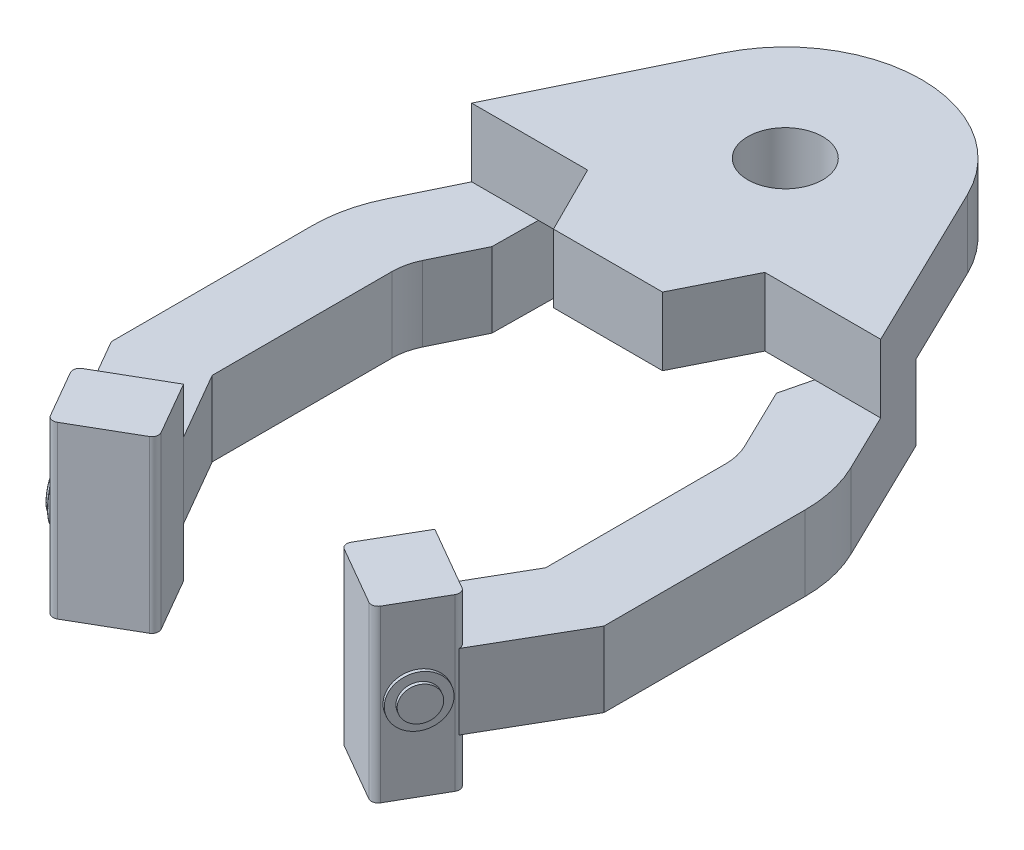
from build123d import *

# Parameters (mm, degrees)
SKETCH1_R           = 0.55
BOSS_EXTRUDE1_DEPTH = 1
BOSS_EXTRUDE3_DEPTH = 1.1
BOSS_EXTRUDE4_DEPTH = 1.25
SKETCH5_R           = 0.375
BOSS_EXTRUDE5_DEPTH = 0.05
SKETCH6_R           = 0.25
BOSS_EXTRUDE6_DEPTH = 0.05
CHAMFER1_SIZE       = 0.75
CHAMFER1_SIZE_2     = 0.5
MIRROR1_START       = -1.1
MIRROR1_DEPTH       = 1.1
MIRROR1_START_2     = -1.8
MIRROR1_2_DEPTH     = 2.5
MIRROR1_START_3     = 6.27611275
MIRROR1_3_OUTLINE_R = 0.375
MIRROR1_3_DEPTH     = 0.05
MIRROR1_START_4     = 6.32611275
MIRROR1_4_OUTLINE_R = 0.25
MIRROR1_4_DEPTH     = 0.05
FILLET2_R           = 0.05
BOSS_EXTRUDE7_DEPTH = 1
FILLET3_R           = 0.1


with BuildPart() as part:
    # Sketch1 → Boss-Extrude1 (new body)
    with BuildSketch(Plane(origin=(0, 0, 0), x_dir=(1, 0, 0), z_dir=(0, 1, 0))):
        with BuildLine():
            Line((-3, -1.6), (-1.799182122, 0.873466479))
            ThreePointArc((-1.799182122, 0.873466479), (0, 2), (1.799182122, 0.873466479))
            Line((1.799182122, 0.873466479), (3, -1.6))
            Line((3, -1.6), (-3, -1.6))
        make_face()
        with Locations(Location((0, 0, 0), (0, 0, 270))):
            Circle(SKETCH1_R, mode=Mode.SUBTRACT)
    extrude(amount=BOSS_EXTRUDE1_DEPTH)

    # Sketch3 → Boss-Extrude3 (add)
    with BuildSketch(Plane(origin=(0, 0, 0), x_dir=(-1, 0, 0), z_dir=(0, -1, 0))):
        with BuildLine():
            Line((2.514520254, -0.6), (3.412657784, -2.45))
            ThreePointArc((3.412657784, -2.45), (3.562510993, -2.875016795), (3.613323348, -3.322803983))
            Line((3.613323348, -3.322803983), (3.613323348, -6.273765877))
            Line((3.613323348, -6.273765877), (2.863323348, -7.572803983))
            Line((2.863323348, -7.572803983), (1.851870719, -6.988841535))
            Line((1.851870719, -6.988841535), (2.445398453, -5.960821345))
            Line((2.445398453, -5.960821345), (2.445398453, -3.322803983))
            ThreePointArc((2.445398453, -3.322803983), (2.424281128, -3.13670618), (2.362002989, -2.960071623))
            Line((2.362002989, -2.960071623), (1.701715763, -1.6))
            Line((1.701715763, -1.6), (2.514520254, -0.6))
        make_face()
    extrude(amount=BOSS_EXTRUDE3_DEPTH)

    # Sketch4 → Boss-Extrude4 (add, symmetric)
    with BuildSketch(Plane(origin=(2.003180044, -0.55, 0.513767997), x_dir=(1, 0, 0), z_dir=(0, 1, 0))):
        Polygon((-3.84639051, -6.470073538), (-4.875163646, -7.064035986), (-4.375163646, -7.930061389), (-3.34639051, -7.336098942), align=None)
    extrude(amount=BOSS_EXTRUDE4_DEPTH, both=True)

    # Sketch5 → Boss-Extrude5 (add)
    with BuildSketch(Plane(origin=(-5.435273078, 0, 3.138056375), x_dir=(0.5000000000000009, 0, 0.8660254037844383), z_dir=(-0.8660254037844382, 0, 0.5000000000000008))):
        with Locations((5.626578953, -0.55)):
            Circle(SKETCH5_R)
    extrude(amount=BOSS_EXTRUDE5_DEPTH)

    # Sketch6 → Boss-Extrude6 (add)
    with BuildSketch(Plane(origin=(-5.478574348, 0, 3.163056375), x_dir=(0.5000000000000008, 0, 0.8660254037844383), z_dir=(-0.8660254037844382, 0, 0.5000000000000007))):
        with Locations((5.626578953, -0.55)):
            Circle(SKETCH6_R)
    extrude(amount=BOSS_EXTRUDE6_DEPTH)

    # Chamfer1
    # the kernel refuses this chamfer: 0.75, 0.5 mm, written as the material it takes off along each edge
    with BuildSketch(Plane(origin=(-1.701715763, 0, 1.6), x_dir=(-0.43673323969900685, 0, 0.899591061172803), z_dir=(0, -1, 0))) as chamfer1_piece_1:
        Polygon((CHAMFER1_SIZE, 0), (-CHAMFER1_SIZE_2 * 0.422618261741, CHAMFER1_SIZE_2 * 0.906307787037), (0, 0), align=None)
    extrude(amount=3.043103543, mode=Mode.SUBTRACT)

    # Mirror1: read off the stored shape, not the designer's step
    # Mirror1 outline → Mirror1 (add)
    with BuildSketch(Plane(origin=(0, 0, 0), x_dir=(1, 0, 0), z_dir=(0, 1, 0)).offset(MIRROR1_START)):
        with BuildLine():
            Line((3.412657784, -2.45), (2.514520254, -0.6))
            Line((2.514520254, -0.6), (2.174766969, -1.01800124))
            Line((2.174766969, -1.01800124), (1.920082383, -2.049795531))
            Line((1.920082383, -2.049795531), (2.362002989, -2.960071623))
            ThreePointArc((2.362002989, -2.960071623), (2.424281128, -3.13670618), (2.445398453, -3.322803983))
            Line((2.445398453, -3.322803983), (2.445398453, -5.960821345))
            Line((2.445398453, -5.960821345), (1.851870719, -6.988841535))
            Line((1.851870719, -6.988841535), (1.843210465, -6.983841535))
            Line((1.843210465, -6.983841535), (1.343210465, -7.849866939))
            Line((1.343210465, -7.849866939), (2.371983602, -8.443829386))
            Line((2.371983602, -8.443829386), (2.871983602, -7.577803983))
            Line((2.871983602, -7.577803983), (2.863323348, -7.572803983))
            Line((2.863323348, -7.572803983), (3.613323348, -6.273765877))
            Line((3.613323348, -6.273765877), (3.613323348, -3.322803983))
            ThreePointArc((3.613323348, -3.322803983), (3.562510993, -2.875016795), (3.412657784, -2.45))
        make_face()
    extrude(amount=MIRROR1_DEPTH)

    # Mirror1 2 outline → Mirror1 2 (add)
    with BuildSketch(Plane(origin=(0, 0, 0), x_dir=(1, 0, 0), z_dir=(0, 1, 0)).offset(MIRROR1_START_2)):
        Polygon((2.871983602, -7.577803983), (1.843210465, -6.983841535), (1.343210465, -7.849866939), (2.371983602, -8.443829386), align=None)
    extrude(amount=MIRROR1_2_DEPTH)

    # Mirror1 3 outline → Mirror1 3 (add)
    with BuildSketch(Plane(origin=(0, 0, 0), x_dir=(0.500000000000001, 0, -0.866025403784438), z_dir=(0.866025403784438, 0, 0.500000000000001)).offset(MIRROR1_START_3)):
        with Locations((-5.626578953, -0.55)):
            Circle(MIRROR1_3_OUTLINE_R)
    extrude(amount=MIRROR1_3_DEPTH)

    # Mirror1 4 outline → Mirror1 4 (add)
    with BuildSketch(Plane(origin=(0, 0, 0), x_dir=(0.500000000000001, 0, -0.866025403784438), z_dir=(0.866025403784438, 0, 0.500000000000001)).offset(MIRROR1_START_4)):
        with Locations((-5.626578953, -0.55)):
            Circle(MIRROR1_4_OUTLINE_R)
    extrude(amount=MIRROR1_4_DEPTH)

    # Fillet2
    fillet2_edges = [part.edges().sort_by_distance(p)[0] for p in [
        (-2.852784872, -0.55, 7.711057158),
        (-2.833586142, -0.55, 7.844310334),
    ]]
    fillet(fillet2_edges, radius=FILLET2_R - 0.0001)  # a hair under: the kernel refuses the full size

    # Sketch7 → Boss-Extrude7 (add)
    with BuildSketch(Plane(origin=(0, 0, 0), x_dir=(1, 0, 0), z_dir=(0, 1, 0))):
        Polygon((-0.8, -2.6), (0.8, -2.6), (1.3, -1.6), (0, -0.8), (-1.3, -1.6), align=None)
    extrude(amount=BOSS_EXTRUDE7_DEPTH)

    # Fillet3
    # the kernel refuses this fillet: 0.1 mm, written as the material it takes off along each edge
    with BuildSketch(Plane(origin=(2.871983602, -1.1, 7.577803983), x_dir=(-0.8660254028383251, 0, -0.5000000016387168), z_dir=(0, 1, 0))) as fillet3_piece_1_section:
        with BuildLine():
            CenterArc((FILLET3_R * 0.9999999985, FILLET3_R), FILLET3_R, 180.000000086, 89.999999914)
            Line((-FILLET3_R * 1.50001067123e-09, FILLET3_R * 0.9999999985), (0, 0))
            Line((0, 0), (FILLET3_R * 0.9999999985, 0))
        make_face()
    fillet3_piece_1 = extrude(amount=1.1, mode=Mode.PRIVATE)
    fillet3_piece_1 = split(fillet3_piece_1, bisect_by=Plane(origin=(2.863323348, -1.1, 7.572803983), z_dir=(0.8660254038383292, 0, 0.49999999990665916)), keep=Keep.TOP, mode=Mode.PRIVATE)
    add(fillet3_piece_1, mode=Mode.SUBTRACT)
    with BuildSketch(Plane(origin=(2.371983602, 0.95, 8.443829386), x_dir=(0.5000000003396727, 0, -0.8660254035883286), z_dir=(0, -1, 0)), Plane(origin=(1.343210465, -2.05, 7.849866939), x_dir=(0.4999999999066601, 0, -0.8660254038383285), z_dir=(0, 1, 0)), Plane(origin=(-2.371983602, -2.05, 8.443829386), x_dir=(-0.5000000000000007, 0, -0.8660254037844383), z_dir=(0, 1, 0))) as fillet3_piece_2:
        with BuildLine():
            CenterArc((FILLET3_R, -FILLET3_R), FILLET3_R, 90, 89.999999953)
            Line((0, -FILLET3_R), (0, 0))
            Line((0, 0), (FILLET3_R, 0))
        make_face()
    extrude(amount=3, mode=Mode.SUBTRACT)
    with BuildSketch(Plane(origin=(-2.871983602, -2.05, 7.577803983), x_dir=(0.5000000000000002, 0, 0.8660254037844386), z_dir=(0, 1, 0))) as fillet3_piece_3_section:
        with BuildLine():
            CenterArc((FILLET3_R, FILLET3_R), FILLET3_R, 180, 90)
            Line((0, FILLET3_R), (0, 0))
            Line((0, 0), (FILLET3_R, 0))
        make_face()
    fillet3_piece_3 = extrude(amount=3, mode=Mode.PRIVATE)
    fillet3_piece_3 = split(fillet3_piece_3, bisect_by=Plane(origin=(-2.871983602, -1.1, 7.577803983), z_dir=(0, -1, 0)), keep=Keep.TOP, mode=Mode.PRIVATE)
    fillet3_piece_3 = split(fillet3_piece_3, bisect_by=Plane(origin=(-2.863323348, -2.05, 7.572803983), z_dir=(-0.8660254037844362, 0, 0.5000000000000044)), keep=Keep.TOP, mode=Mode.PRIVATE)
    add(fillet3_piece_3, mode=Mode.SUBTRACT)
    with BuildSketch(Plane(origin=(-2.871983602, -2.05, 7.577803983), x_dir=(0.5000000000000002, 0, 0.8660254037844386), z_dir=(0, 1, 0))) as fillet3_piece_4_section:
        with BuildLine():
            CenterArc((FILLET3_R, FILLET3_R), FILLET3_R, 180, 90)
            Line((0, FILLET3_R), (0, 0))
            Line((0, 0), (FILLET3_R, 0))
        make_face()
    fillet3_piece_4 = extrude(amount=3, mode=Mode.PRIVATE)
    fillet3_piece_4 = split(fillet3_piece_4, bisect_by=Plane(origin=(-2.871983602, -1.1, 7.577803983), z_dir=(0, -1, 0)), keep=Keep.TOP, mode=Mode.PRIVATE)
    fillet3_piece_4 = split(fillet3_piece_4, bisect_by=Plane(origin=(-2.863323348, -2.05, 7.572803983), z_dir=(0.8660254037844362, 0, -0.5000000000000044)), keep=Keep.TOP, mode=Mode.PRIVATE)
    add(fillet3_piece_4, mode=Mode.SUBTRACT)
    with BuildSketch(Plane(origin=(-2.871983602, -2.05, 7.577803983), x_dir=(0.5000000000000002, 0, 0.8660254037844386), z_dir=(0, 1, 0))) as fillet3_piece_5_section:
        with BuildLine():
            CenterArc((FILLET3_R, FILLET3_R), FILLET3_R, 180, 90)
            Line((0, FILLET3_R), (0, 0))
            Line((0, 0), (FILLET3_R, 0))
        make_face()
    fillet3_piece_5 = extrude(amount=3, mode=Mode.PRIVATE)
    fillet3_piece_5 = split(fillet3_piece_5, bisect_by=Plane(origin=(-2.871983602, 0, 7.577803983), z_dir=(0, -1, 0)), keep=Keep.TOP, mode=Mode.PRIVATE)
    fillet3_piece_5 = split(fillet3_piece_5, bisect_by=Plane(origin=(-2.871983602, -1.1, 7.577803983), z_dir=(0, 1, 0)), keep=Keep.TOP, mode=Mode.PRIVATE)
    fillet3_piece_5 = split(fillet3_piece_5, bisect_by=Plane(origin=(-2.863323348, -2.05, 7.572803983), z_dir=(-0.8660254037844362, 0, 0.5000000000000044)), keep=Keep.TOP, mode=Mode.PRIVATE)
    add(fillet3_piece_5, mode=Mode.SUBTRACT)
    with BuildSketch(Plane(origin=(-2.871983602, -2.05, 7.577803983), x_dir=(0.5000000000000002, 0, 0.8660254037844386), z_dir=(0, 1, 0))) as fillet3_piece_6_section:
        with BuildLine():
            CenterArc((FILLET3_R, FILLET3_R), FILLET3_R, 180, 90)
            Line((0, FILLET3_R), (0, 0))
            Line((0, 0), (FILLET3_R, 0))
        make_face()
    fillet3_piece_6 = extrude(amount=3, mode=Mode.PRIVATE)
    fillet3_piece_6 = split(fillet3_piece_6, bisect_by=Plane(origin=(-2.871983602, 0, 7.577803983), z_dir=(0, 1, 0)), keep=Keep.TOP, mode=Mode.PRIVATE)
    fillet3_piece_6 = split(fillet3_piece_6, bisect_by=Plane(origin=(-2.863323348, -2.05, 7.572803983), z_dir=(-0.8660254037844362, 0, 0.5000000000000044)), keep=Keep.TOP, mode=Mode.PRIVATE)
    add(fillet3_piece_6, mode=Mode.SUBTRACT)
    with BuildSketch(Plane(origin=(-2.871983602, -2.05, 7.577803983), x_dir=(0.5000000000000002, 0, 0.8660254037844386), z_dir=(0, 1, 0))) as fillet3_piece_7_section:
        with BuildLine():
            CenterArc((FILLET3_R, FILLET3_R), FILLET3_R, 180, 90)
            Line((0, FILLET3_R), (0, 0))
            Line((0, 0), (FILLET3_R, 0))
        make_face()
    fillet3_piece_7 = extrude(amount=3, mode=Mode.PRIVATE)
    fillet3_piece_7 = split(fillet3_piece_7, bisect_by=Plane(origin=(-2.871983602, 0, 7.577803983), z_dir=(0, 1, 0)), keep=Keep.TOP, mode=Mode.PRIVATE)
    fillet3_piece_7 = split(fillet3_piece_7, bisect_by=Plane(origin=(-2.863323348, -2.05, 7.572803983), z_dir=(0.8660254037844362, 0, -0.5000000000000044)), keep=Keep.TOP, mode=Mode.PRIVATE)
    add(fillet3_piece_7, mode=Mode.SUBTRACT)
    with BuildSketch(Plane(origin=(-1.343210465, 0.95, 7.849866939), x_dir=(-0.8660254037844438, 0, 0.4999999999999912), z_dir=(0, -1, 0))) as fillet3_piece_8:
        with BuildLine():
            CenterArc((FILLET3_R, FILLET3_R), FILLET3_R, 180, 90)
            Line((0, FILLET3_R), (0, 0))
            Line((0, 0), (FILLET3_R, 0))
        make_face()
    extrude(amount=3, mode=Mode.SUBTRACT)
    with BuildSketch(Plane(origin=(2.871983602, -2.05, 7.577803983), x_dir=(-0.866025403632075, 0, -0.5000000002639015), z_dir=(0, 1, 0)), Plane(origin=(2.871983602, 0, 7.577803983), x_dir=(-0.866025403632075, 0, -0.5000000002639015), z_dir=(0, 1, 0))) as fillet3_piece_9:
        with BuildLine():
            CenterArc((FILLET3_R, FILLET3_R), FILLET3_R, 179.999999995, 90.000000005)
            Line((0, FILLET3_R), (0, 0))
            Line((0, 0), (FILLET3_R, 0))
        make_face()
    extrude(amount=0.95, mode=Mode.SUBTRACT)


solid = part.part
